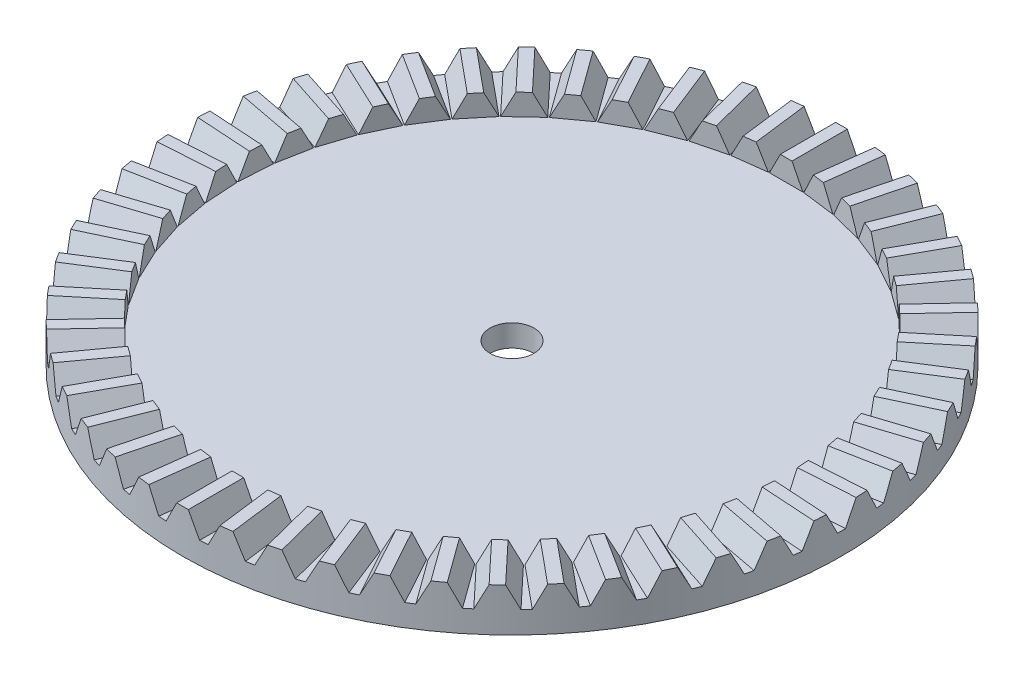
from build123d import *

# Parameters (mm, degrees)
SKETCH3_R           = 30
BOSS_EXTRUDE3_DEPTH = 2
CUT_EXTRUDE1_REACH  = 44.474
SKETCH6_R           = 2
BOSS_EXTRUDE5_DEPTH = 3
CUT_EXTRUDE4_REACH  = 64.813
CIRPATTERN2_COUNT   = 50


with BuildPart() as part:
    # Sketch3 → Boss-Extrude3 (new body)
    with BuildSketch(Plane(origin=(0, 0, 0), x_dir=(1, 0, 0), z_dir=(0, 1, 0))):
        Circle(SKETCH3_R)
    extrude(amount=BOSS_EXTRUDE3_DEPTH)

    # Sketch6 → Cut-Extrude1 (cut, up to next)
    with BuildSketch(Plane(origin=(0, 2, 0), x_dir=(1, 0, 0), z_dir=(0, 1, 0)), mode=Mode.PRIVATE) as cut_extrude1_sk1:
        Circle(SKETCH6_R)
    cut_extrude1_tool1 = extrude(cut_extrude1_sk1.sketch, amount=-CUT_EXTRUDE1_REACH, mode=Mode.PRIVATE) & part.part
    add(cut_extrude1_tool1.solids().sort_by_distance((0, 2, 0))[0], mode=Mode.SUBTRACT)

    # Sketch5 → Boss-Extrude5 (add)
    with BuildSketch(Plane(origin=(0, 2, 0), x_dir=(1, 0, 0), z_dir=(0, 1, 0))):
        with BuildLine():
            Line((-1.570078687, 29.958886043), (-1.570078687, 24.958886043))
            Line((-1.570078687, 24.958886043), (1.570078687, 24.958886043))
            Line((1.570078687, 24.958886043), (1.570078687, 29.958886043))
            ThreePointArc((1.570078687, 29.958886043), (0, 30), (-1.570078687, 29.958886043))
        make_face()
    boss_extrude5 = extrude(amount=BOSS_EXTRUDE5_DEPTH)

    # Sketch14 → Cut-Extrude4 (cut, up to next)
    with BuildSketch(Plane.XY.offset(-24.958886043), mode=Mode.PRIVATE) as cut_extrude4_sk1:
        Polygon((-1.570078687, 5), (-1.570078687, 2), (-1.520078687, 2), (-0.532027541, 3.95), (0.532027541, 3.95), (1.520078687, 2), (1.570078687, 2), (1.570078687, 5), align=None)
    cut_extrude4_tool1 = extrude(cut_extrude4_sk1.sketch, amount=-CUT_EXTRUDE4_REACH, mode=Mode.PRIVATE) & part.part
    cut_extrude4 = cut_extrude4_tool1.solids().sort_by_distance((0, 4.003246, -24.958886))[0]
    add(cut_extrude4, mode=Mode.SUBTRACT)

    # CirPattern2: Boss-Extrude5, Cut-Extrude4 ×50 about axis
    cirpattern2_axis = Axis((0, -0.001, 0), (0, 1, 0))
    add([boss_extrude5.rotate(cirpattern2_axis, i * 360 / CIRPATTERN2_COUNT) for i in range(1, CIRPATTERN2_COUNT)])
    add([cut_extrude4.rotate(cirpattern2_axis, i * 360 / CIRPATTERN2_COUNT) for i in range(1, CIRPATTERN2_COUNT)], mode=Mode.SUBTRACT)


solid = part.part
